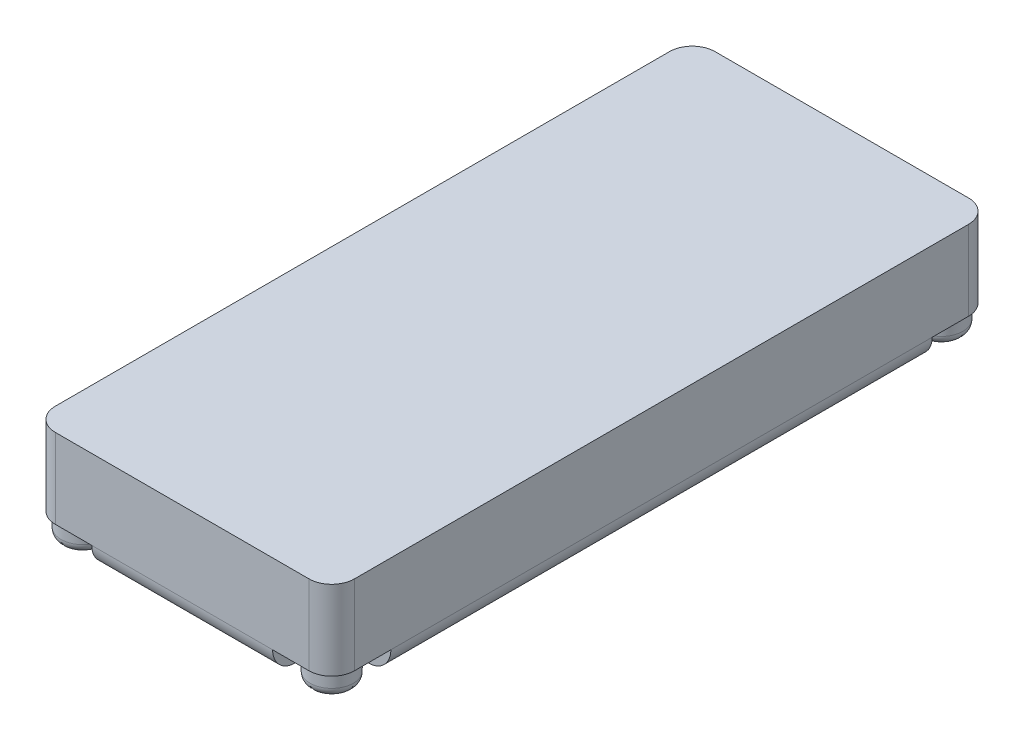
from build123d import *

# Parameters (mm, degrees)
SKETCH1_W            = 13.15
SKETCH1_H            = 29
BOSS_EXTRUDE1_DEPTH  = 4.5
CUT_EXTRUDE1_DEPTH   = 1
SKETCH5_R            = 0.95
BOSS_EXTRUDE3_DEPTH  = 1
FILLET2_R            = 0.4
CUT_EXTRUDE3_START   = 4.5249999
CUT_EXTRUDE3_DEPTH   = 1.9000002
CUT_EXTRUDE3_START_2 = -14.325049729
CUT_EXTRUDE3_2_DEPTH = 1.850099512
CUT_EXTRUDE3_START_3 = 5.443090347
CUT_EXTRUDE3_3_DEPTH = 0.063817292
FILLET3_R            = 1
FILLET4_R            = 1


with BuildPart() as part:
    # Sketch1 → Boss-Extrude1 (new body)
    with BuildSketch(Plane(origin=(0, 0, 0), x_dir=(1, 0, 0), z_dir=(0, 1, 0))):
        Rectangle(SKETCH1_W, SKETCH1_H)
    extrude(amount=BOSS_EXTRUDE1_DEPTH)

    # Sketch2 → Cut-Extrude1 (cut)
    with BuildSketch(Plane.XZ):
        with BuildLine():
            Line((6.575, -14.5), (3.975, -14.5))
            Line((3.975, -14.5), (3.975, -13.4))
            ThreePointArc((3.975, -13.4), (4.414339828, -12.339339828), (5.475, -11.9))
            Line((5.475, -11.9), (6.575, -11.9))
            Line((6.575, -11.9), (6.575, -14.5))
        make_face()
    extrude(amount=-CUT_EXTRUDE1_DEPTH, mode=Mode.SUBTRACT)

    # Sketch5 → Boss-Extrude3 (add)
    with BuildSketch(Plane.XZ.offset(-1)):
        with Locations(Location((5.475, -13.4, 0), (0, 0, 90))):
            Circle(SKETCH5_R)
    extrude(amount=BOSS_EXTRUDE3_DEPTH)

    # Fillet2
    fillet2_edges = [part.edges().sort_by_distance(p)[0] for p in [
        (5.475, 0, -14.35),
    ]]
    fillet(fillet2_edges, radius=FILLET2_R)

    # Cut-Extrude3: read off the stored shape, not the designer's step
    # Cut-Extrude3 outline → Cut-Extrude3 (cut)
    with BuildSketch(Plane.YZ.offset(CUT_EXTRUDE3_START)):
        Polygon((0, -13.494607759), (0.259932682, -13.4), (0, -13.305392241), align=None)
    extrude(amount=CUT_EXTRUDE3_DEPTH, mode=Mode.SUBTRACT)

    # Cut-Extrude3 2 outline → Cut-Extrude3 2 (cut)
    with BuildSketch(Plane.XY.offset(CUT_EXTRUDE3_START_2)):
        Polygon((5.602425302, 0), (5.475, 0.350098139), (5.347574698, 0), align=None)
    extrude(amount=CUT_EXTRUDE3_2_DEPTH, mode=Mode.SUBTRACT)

    # Cut-Extrude3 3 outline → Cut-Extrude3 3 (add)
    with BuildSketch(Plane.YZ.offset(CUT_EXTRUDE3_START_3)):
        Polygon((0.262432065, -12.474950217), (0.350098139, -12.506858059), (2, -13.107373235), (2, -12.474950217), align=None)
        Polygon((2, -14.325049729), (2, -13.69262677), (0.350098139, -14.293141941), (0.262432213, -14.325049729), align=None)
    extrude(amount=CUT_EXTRUDE3_3_DEPTH)

    # Mirror6: read off the stored shape, not the designer's step
    # Mirror6
    split(bisect_by=Plane(origin=(0, 0, 0), x_dir=(0, 0, 1), z_dir=(1, 0, 0)), keep=Keep.TOP)

    # Mirror6 2: part across plane


with BuildPart() as part_1:
    add(part.part)
    add(part.part.mirror(Plane(origin=(0, 0, 0), x_dir=(0, 0, 1), z_dir=(1, 0, 0))))

    # Mirror7: read off the stored shape, not the designer's step
    # Mirror7
    split(bisect_by=Plane.XY, keep=Keep.BOTTOM)

    # Mirror7 2: part across plane


with BuildPart() as part_2:
    add(part_1.part)
    add(part_1.part.mirror(Plane.XY))

    # Fillet3
    fillet3_edges = [part_2.edges().sort_by_distance(p)[0] for p in [
        (0, 0, -14.5),
        (-6.575, 0, 0),
        (0, 0, 14.5),
        (6.575, 0, 0),
    ]]
    fillet(fillet3_edges, radius=FILLET3_R)

    # Fillet4
    fillet4_edges = [part_2.edges().sort_by_distance(p)[0] for p in [
        (-6.575, 2.75, -14.5),
        (6.575, 2.75, -14.5),
        (6.575, 2.75, 14.5),
        (-6.575, 2.75, 14.5),
    ]]
    fillet(fillet4_edges, radius=FILLET4_R)


solid = part_2.part
